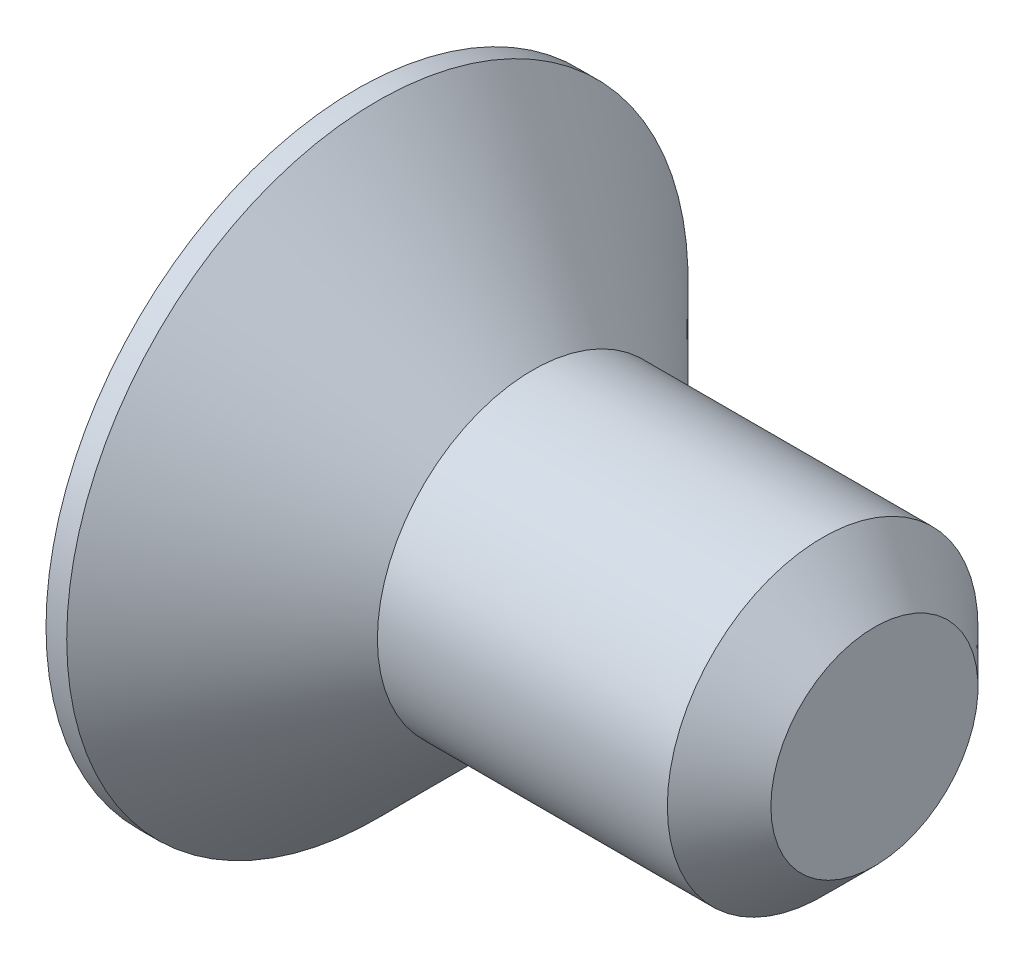
from build123d import *

# Parameters (mm, degrees)
CUT_EXTRUDE1_DEPTH = 1.1


with BuildPart() as part:
    # Sketch1 → Revolve1 (revolve)
    with BuildSketch(Plane.XY):
        Polygon((0, -1.5), (2.8, -1.5), (3.3, -1), (3.3, 0), (-1.7, 0), (-1.7, -3), (-1.5, -3), align=None)
    revolve(axis=Axis((-1.7, 0, 0), (1, 0, 0)))

    # Sketch2 → Cut-Extrude1 (cut)
    with BuildSketch(Plane.ZY.offset(1.7)):
        Polygon((0, 1.154700538), (-1, 0.577350269), (-1, -0.577350269), (0, -1.154700538), (1, -0.577350269), (1, 0.577350269), align=None)
    extrude(amount=-CUT_EXTRUDE1_DEPTH, mode=Mode.SUBTRACT)


solid = part.part
